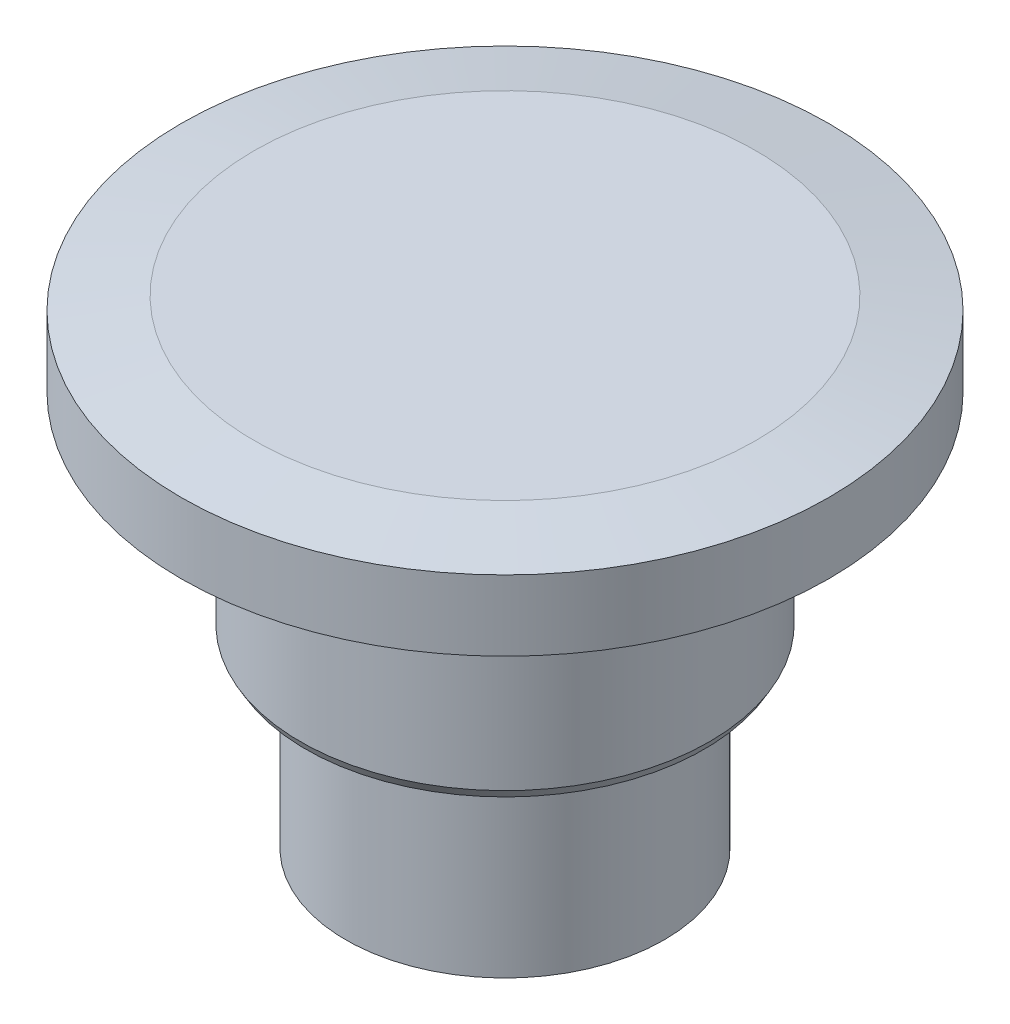
from build123d import *

# Parameters (mm, degrees)
CHAMFER2_SIZE                  = 8.144346428
CHAMFER2_SIZE_2                = 1
SKETCH8_R                      = 8.6
SKETCH8_R_2                    = 5.6
BOSS_EXTRUDE7_DEPTH            = 10
CUT_EXTRUDE1_REACH             = 35.014
CUT_EXTRUDE1_DIRECTION_2_REACH = 35.014
CHAMFER1_SIZE                  = 1
CHAMFER3_SIZE                  = 0.5
CHAMFER3_SIZE2                 = 0.288675135


with BuildPart() as part:
    # Sketch1 → Revolve1 (revolve)
    with BuildSketch(Plane.XY, mode=Mode.PRIVATE) as revolve1_sk:
        Polygon((-13.560768988, 5.5), (-17.5, 4.805407289), (-17.5, 0), (-12.05, 0), (-12.05, -0.35), (-11.05, -0.35), (-11.05, -10.35), (-5.6, -10.35), (-5.6, -10.1), (-3, -10.1), (-3, -16.35), (0, -16.35), (0, 5.5), align=None)
    revolve(revolve1_sk.sketch.rotate(Axis((0, -16.35, 0), (0, 1, 0)), 180), axis=Axis((0, -16.35, 0), (0, 1, 0)))

    # Chamfer2
    # the kernel refuses this chamfer: 8.144346428, 1 mm, written as the material it takes off along each edge
    with BuildSketch(Plane(origin=(0, 0, 0), x_dir=(1, 0, 0), z_dir=(0, 0, 1))) as chamfer2_piece_1_section:
        Polygon((17.5 - CHAMFER2_SIZE, 0), (17.5, CHAMFER2_SIZE_2), (17.5, 0), align=None)
    chamfer2_piece_1 = revolve(axis=Axis((0, 0, 0), (0, 1, 0)), mode=Mode.PRIVATE)
    chamfer2_piece_1 = chamfer2_piece_1 - Plane(origin=(0, 0.608985378, 0), x_dir=(1, 0, 0), z_dir=(0, -1, 0)) * Cylinder(12.05, 70, mode=Mode.PRIVATE)
    add(chamfer2_piece_1, mode=Mode.SUBTRACT)

    # Sketch8 → Boss-Extrude7 (add)
    with BuildSketch(Plane.XZ.offset(10.35)):
        Circle(SKETCH8_R)
        Circle(SKETCH8_R_2, mode=Mode.SUBTRACT)
    extrude(amount=BOSS_EXTRUDE7_DEPTH)

    # Cut-Extrude1: up to this face of the body (flat: up to its plane)
    cut_extrude1_end = Plane(part.part.faces().sort_by_distance((-5.441608081, -10.1, 0))[0])
    # Sketch2 → Cut-Extrude1 (cut, up to the picked face)
    with BuildSketch(Plane.XZ.offset(16.35), mode=Mode.PRIVATE) as cut_extrude1_sk1:
        Polygon((-6.25, 1.85), (-7, 1.1), (-7, -1.1), (-6.25, -1.85), (-0.75, -1.85), (0, -1.1), (0, 1.1), (-0.75, 1.85), align=None)
    cut_extrude1_tool1 = split(extrude(cut_extrude1_sk1.sketch, amount=-CUT_EXTRUDE1_REACH, mode=Mode.PRIVATE), bisect_by=cut_extrude1_end, keep=Keep.BOTH, mode=Mode.PRIVATE)
    add(cut_extrude1_tool1.solids().sort_by(Axis((-3.5, -16.35, 0), (0, 1, 0)))[0], mode=Mode.SUBTRACT)

    # Cut-Extrude1 direction 2: up to this face of the body (flat: up to its plane)
    cut_extrude1_direction_2_end = Plane(part.part.faces().sort_by_distance((-8.356755267, -20.35, 0))[0])
    # Sketch2 → Cut-Extrude1 direction 2 (cut, up to the picked face)
    with BuildSketch(Plane.XZ.offset(16.35), mode=Mode.PRIVATE) as cut_extrude1_direction_2_sk1:
        Polygon((-6.25, 1.85), (-7, 1.1), (-7, -1.1), (-6.25, -1.85), (-0.75, -1.85), (0, -1.1), (0, 1.1), (-0.75, 1.85), align=None)
    cut_extrude1_direction_2_tool1 = split(extrude(cut_extrude1_direction_2_sk1.sketch, amount=CUT_EXTRUDE1_DIRECTION_2_REACH, mode=Mode.PRIVATE), bisect_by=cut_extrude1_direction_2_end, keep=Keep.BOTH, mode=Mode.PRIVATE)
    add(cut_extrude1_direction_2_tool1.solids().sort_by(Axis((-3.5, -16.35, 0), (0, -1, 0)))[0], mode=Mode.SUBTRACT)

    # Chamfer1
    chamfer1_edges = [part.edges().sort_by_distance(p)[0] for p in [
        (5.6, -20.35, 0),
    ]]
    chamfer(chamfer1_edges, length=CHAMFER1_SIZE)

    # Chamfer3
    chamfer3_edges = [part.edges().sort_by_distance(p)[0] for p in [
        (-11.05, -10.35, 0),
    ]]
    chamfer3_side = [part.faces().sort_by_distance(p)[0] for p in [
        (-11.05, -5.35, 0),
    ]]
    chamfer(chamfer3_edges, length=CHAMFER3_SIZE, length2=CHAMFER3_SIZE2, reference=chamfer3_side[0])


solid = part.part
